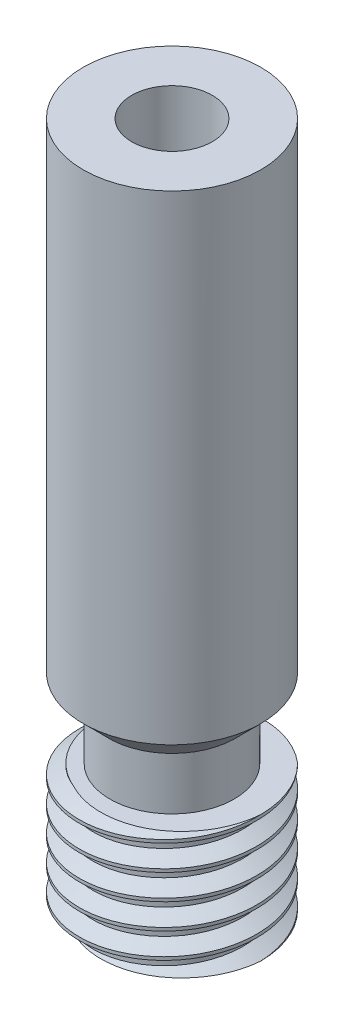
from build123d import *

# Parameters (mm, degrees)
CROQUIS2_R                   = 3.5
SALIENTE_EXTRUIR1_DEPTH      = 27
ROSCA1_PITCH                 = 1
CROQUIS5_R                   = 12.45
CROQUIS5_R_2                 = 2.45
CORTAR_EXTRUIR_L_MINA1_DEPTH = 2.1
CROQUIS6_R                   = 1.2
CORTAR_EXTRUIR1_DEPTH        = 28.449954628
CHAFL_N1_SIZE                = 1
CROQUIS8_R                   = 1.5875
CORTAR_EXTRUIR2_DEPTH        = 5
CHAFL_N2_SIZE                = 1


with BuildPart() as part:
    # Croquis2 → Saliente-Extruir1 (new body)
    with BuildSketch(Plane(origin=(0, 0, 0), x_dir=(1, 0, 0), z_dir=(0, 1, 0))):
        with Locations(Location((0, 0, 0), (0, 0, 270))):
            Circle(CROQUIS2_R)
    extrude(amount=SALIENTE_EXTRUIR1_DEPTH)

    # Rosca1: the profile of Perfil de rosca1 profile screwed along a right-hand helix of 6 turns, 8 arcs to a turn; built about Z, then put on its axis
    rosca1_z = Axis((0, 0, 0), (0, 0, 1))
    rosca1_corners = [(3.5003, 0, -0.000173205), (3.5003, 0, 0.875173202), (2.958734125, 0, 0.562499999), (2.958734125, 0, 0.312499999)]
    with BuildLine(mode=Mode.PRIVATE) as rosca1_profile:
        Line(rosca1_corners[0], rosca1_corners[1])
        Line(rosca1_corners[1], rosca1_corners[2])
        Line(rosca1_corners[2], rosca1_corners[3])
        Line(rosca1_corners[3], rosca1_corners[0])
    rosca1_cap = Face(rosca1_profile.wire())
    rosca1_turn_angles = [0, 22.5, 45, 67.5, 90, 112.5, 135, 157.5, 180, 202.5, 225, 247.5, 270, 292.5, 315, 337.5, 360]
    rosca1_turn_weights = [1, 0.9238795325112867, 1, 0.9238795325112867, 1, 0.9238795325112867, 1, 0.9238795325112867, 1, 0.9238795325112867, 1, 0.9238795325112867, 1, 0.9238795325112867, 1, 0.9238795325112867, 1]
    rosca1_turn_rails = [Edge.make_bspline([Vector(p[0], p[1], 0).rotate(rosca1_z, rosca1_turn_angles[k]) / rosca1_turn_weights[k] + Vector(0, 0, p[2] + ROSCA1_PITCH * rosca1_turn_angles[k] / 360) for k in range(17)], [0, 0, 0, 1, 1, 2, 2, 3, 3, 4, 4, 5, 5, 6, 6, 7, 7, 8, 8, 8], 2, rosca1_turn_weights) for p in rosca1_corners]
    rosca1_turn_sides = [Face.make_surface_from_curves(rosca1_turn_rails[p[0]], rosca1_turn_rails[p[1]]) for p in [(0, 1), (1, 2), (2, 3), (3, 0)]]
    rosca1 = Plane(origin=(0, -1, 0), x_dir=(1, 0, 0), z_dir=(0, 1, 0)) * Solid(Shell([*[p.moved(Location((0, 0, ROSCA1_PITCH * i))) for i in range(6) for p in rosca1_turn_sides], rosca1_cap, rosca1_cap.rotate(rosca1_z, 2160).moved(Location((0, 0, ROSCA1_PITCH * 2160 / 360)))]))
    add(rosca1, mode=Mode.SUBTRACT)

    # Croquis5 → Cortar-Extruir-Lámina1 (cut)
    with BuildSketch(Plane(origin=(0, 5, 0), x_dir=(-1, 0, 0), z_dir=(0, -1, 0))):
        Circle(CROQUIS5_R)
        Circle(CROQUIS5_R_2, mode=Mode.SUBTRACT)
    extrude(amount=-CORTAR_EXTRUIR_L_MINA1_DEPTH, mode=Mode.SUBTRACT)

    # Croquis6 → Cortar-Extruir1 (cut, through all)
    with BuildSketch(Plane(origin=(0, 27, 0), x_dir=(1, 0, 0), z_dir=(0, 1, 0))):
        with Locations(Location((0, 0, 0), (0, 0, 270))):
            Circle(CROQUIS6_R)
    extrude(amount=-CORTAR_EXTRUIR1_DEPTH, mode=Mode.SUBTRACT)

    # Chaflán1
    chafl_n1_edges = [part.edges().sort_by_distance(p)[0] for p in [
        (0, 7.1, -3.5),
    ]]
    chamfer(chafl_n1_edges, length=CHAFL_N1_SIZE)

    # Croquis8 → Cortar-Extruir2 (cut)
    with BuildSketch(Plane(origin=(0, 27, 0), x_dir=(1, 0, 0), z_dir=(0, 1, 0))):
        with Locations(Location((0, 0, 0), (0, 0, 270))):
            Circle(CROQUIS8_R)
    extrude(amount=-CORTAR_EXTRUIR2_DEPTH, mode=Mode.SUBTRACT)

    # Chaflán2
    # the kernel refuses this chamfer: 1 mm, written as the material it takes off along each edge
    with BuildSketch(Plane(origin=(0, 22, 0), x_dir=(0, 0, 1), z_dir=(-1, 0, 0))) as chafl_n2_piece_1_section:
        Polygon((1.2 + CHAFL_N2_SIZE, 0), (1.2, -CHAFL_N2_SIZE), (1.2, 0), align=None)
    chafl_n2_piece_1 = revolve(axis=Axis((0, 22, 0), (0, 1, 0)), mode=Mode.PRIVATE)
    chafl_n2_piece_1 = chafl_n2_piece_1 & Plane(origin=(0, 21.189751439, 0), x_dir=(0, 0, 1), z_dir=(0, 1, 0)) * Cylinder(1.5875, 9, mode=Mode.PRIVATE)
    add(chafl_n2_piece_1, mode=Mode.SUBTRACT)


solid = part.part
